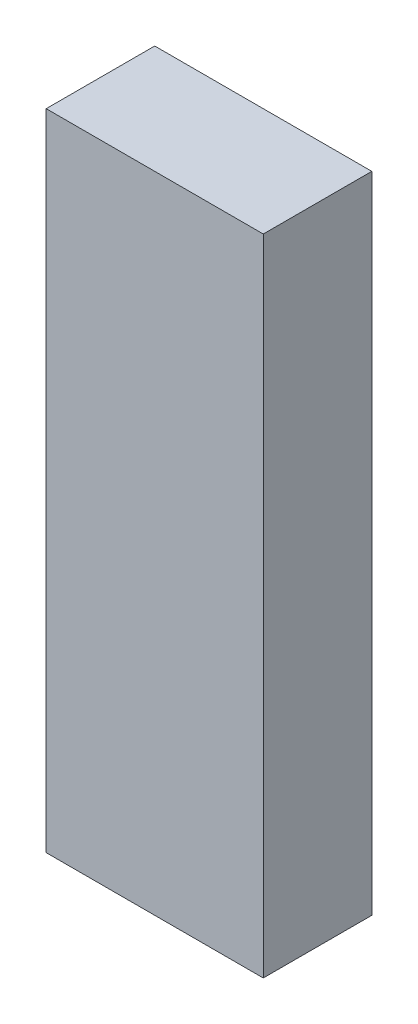
from build123d import *

# Parameters (mm, degrees)
SKETCH1_W           = 400
SKETCH1_H           = 200
BOSS_EXTRUDE1_DEPTH = 1187.25


with BuildPart() as part:
    # Sketch1 → Boss-Extrude1 (new body)
    with BuildSketch(Plane(origin=(0, 0, 0), x_dir=(1, 0, 0), z_dir=(0, 1, 0))):
        Rectangle(SKETCH1_W, SKETCH1_H)
    extrude(amount=BOSS_EXTRUDE1_DEPTH)


solid = part.part
